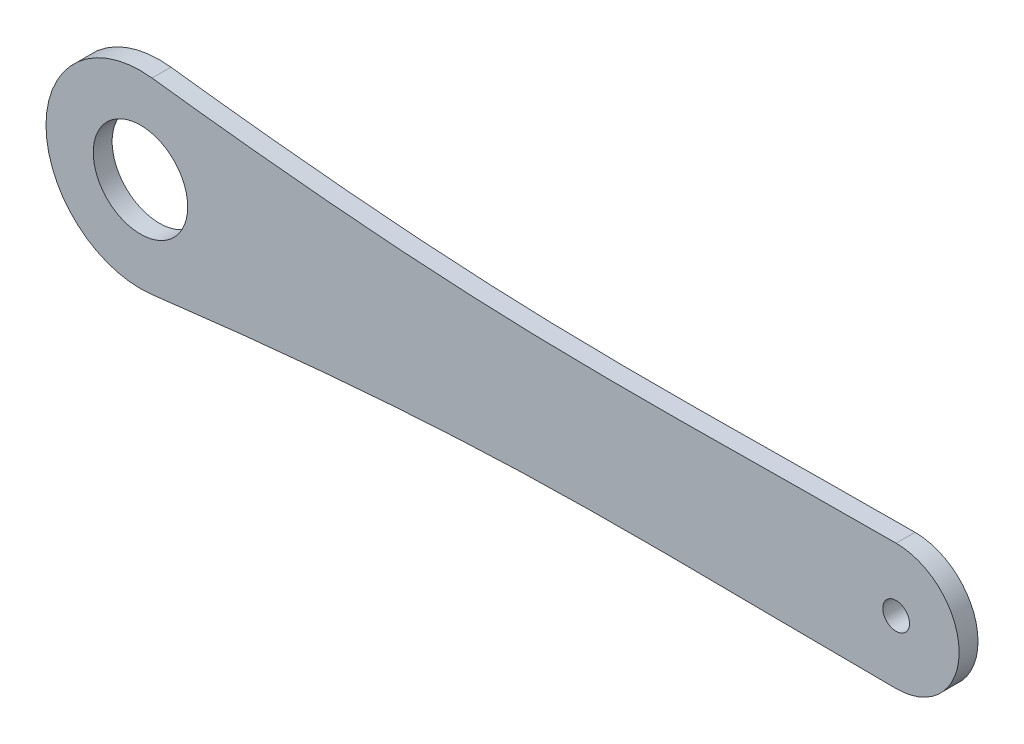
from build123d import *

# Parameters (mm, degrees)
SKETCH1_R           = 7.5
SKETCH1_R_2         = 2.125
BOSS_EXTRUDE1_DEPTH = 3


with BuildPart() as part:
    # Sketch1 → Boss-Extrude1 (new body)
    with BuildSketch(Plane.XY):
        with BuildLine():
            ThreePointArc((-58.16217497, 14.886987578), (-75, 0), (-58.16217497, -14.886987578))
            add(Edge.make_bspline(
                [(60, -10), (39.938914333, -10), (0.518378477, -8.716527288), (-38.803194249, -12.49708706), (-58.16217497, -14.886987578)],
                knots=[0, 0, 0, 0, 0.506897503, 1, 1, 1, 1], degree=3))
            ThreePointArc((60, -10), (70, 0), (60, 10))
            add(Edge.make_bspline(
                [(60, 10), (39.938914333, 10), (0.518378477, 8.716527288), (-38.803194249, 12.49708706), (-58.16217497, 14.886987578)],
                knots=[0, 0, 0, 0, 0.506897503, 1, 1, 1, 1], degree=3))
        make_face()
        with Locations((-60, 0)):
            Circle(SKETCH1_R, mode=Mode.SUBTRACT)
        with Locations((60, 0)):
            Circle(SKETCH1_R_2, mode=Mode.SUBTRACT)
    extrude(amount=BOSS_EXTRUDE1_DEPTH)


solid = part.part
